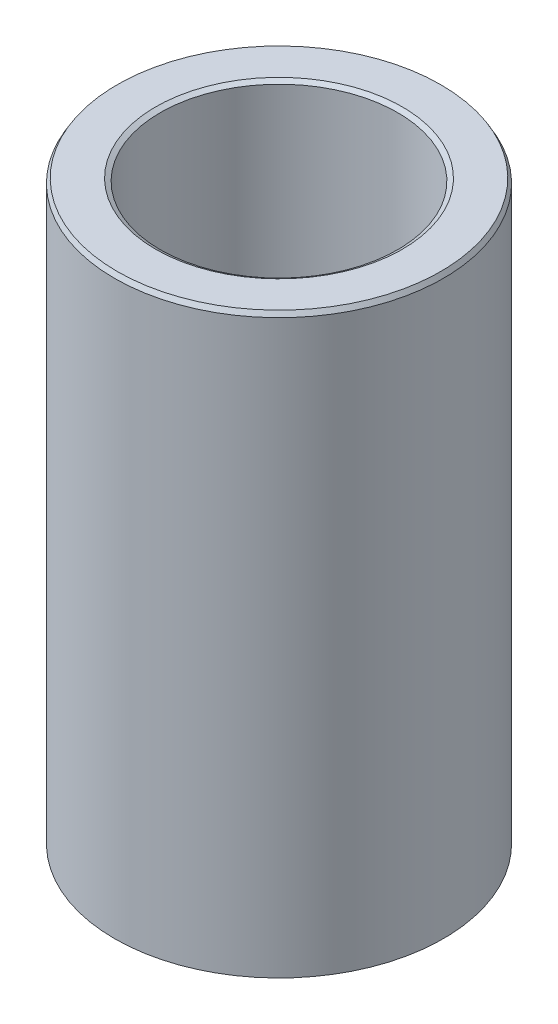
from build123d import *
from OCP.BRepFilletAPI import BRepFilletAPI_MakeChamfer

# Parameters (mm, degrees)
SKETCH1_R           = 47.5
BOSS_EXTRUDE1_DEPTH = 167.271061437
SKETCH2_R           = 34.297368859
CUT_EXTRUDE1_DEPTH  = 181.255673958
CHAMFER1_SIZE       = 1.3358526
CHAMFER1_SIZE2      = 0.771254858


with BuildPart() as part:
    # Sketch1 → Boss-Extrude1 (new body)
    with BuildSketch(Plane(origin=(0, 0, 0), x_dir=(1, 0, 0), z_dir=(0, 1, 0))):
        Circle(SKETCH1_R)
    extrude(amount=BOSS_EXTRUDE1_DEPTH)

    # Sketch2 → Cut-Extrude1 (cut, through all)
    with BuildSketch(Plane(origin=(0, 0, 0), x_dir=(1, 0, 0), z_dir=(0, 1, 0))):
        Circle(SKETCH2_R)
    extrude(amount=CUT_EXTRUDE1_DEPTH, mode=Mode.SUBTRACT)

    # Chamfer1: one chamfer whose edges measure the first distance from different faces: ONE call of the kernel's chamfer builder (chamfer() names one face for all edges)
    chamfer1_edges_1 = [part.edges().sort_by_distance(p)[0] for p in [
        (-34.297368859, 167.271061437, 0),
    ]]
    chamfer1_side_1 = [part.faces().sort_by_distance(p)[0] for p in [
        (-46.156497116, 167.271061437, 0),
    ]]
    chamfer1_edges_2 = [part.edges().sort_by_distance(p)[0] for p in [
        (-34.297368859, 0, 0),
    ]]
    chamfer1_side_2 = [part.faces().sort_by_distance(p)[0] for p in [
        (-34.297368859, 83.635530718, 0),
    ]]
    chamfer1_edges_3 = [part.edges().sort_by_distance(p)[0] for p in [
        (-47.5, 0, 0),
    ]]
    chamfer1_side_3 = [part.faces().sort_by_distance(p)[0] for p in [
        (-46.156497116, 0, 0),
    ]]
    chamfer1_edges_4 = [part.edges().sort_by_distance(p)[0] for p in [
        (-47.5, 167.271061437, 0),
    ]]
    chamfer1_side_4 = [part.faces().sort_by_distance(p)[0] for p in [
        (-47.5, 83.635530718, 0),
    ]]
    chamfer1 = BRepFilletAPI_MakeChamfer(part.part.solid().wrapped)
    for e in chamfer1_edges_1:
        chamfer1.Add(CHAMFER1_SIZE, CHAMFER1_SIZE2, e.wrapped, chamfer1_side_1[0].wrapped)  # the first distance lies on this face
    for e in chamfer1_edges_2:
        chamfer1.Add(CHAMFER1_SIZE, CHAMFER1_SIZE2, e.wrapped, chamfer1_side_2[0].wrapped)  # the first distance lies on this face
    for e in chamfer1_edges_3:
        chamfer1.Add(CHAMFER1_SIZE, CHAMFER1_SIZE2, e.wrapped, chamfer1_side_3[0].wrapped)  # the first distance lies on this face
    for e in chamfer1_edges_4:
        chamfer1.Add(CHAMFER1_SIZE, CHAMFER1_SIZE2, e.wrapped, chamfer1_side_4[0].wrapped)  # the first distance lies on this face
    add(Compound.cast(chamfer1.Shape()), mode=Mode.REPLACE)


solid = part.part
